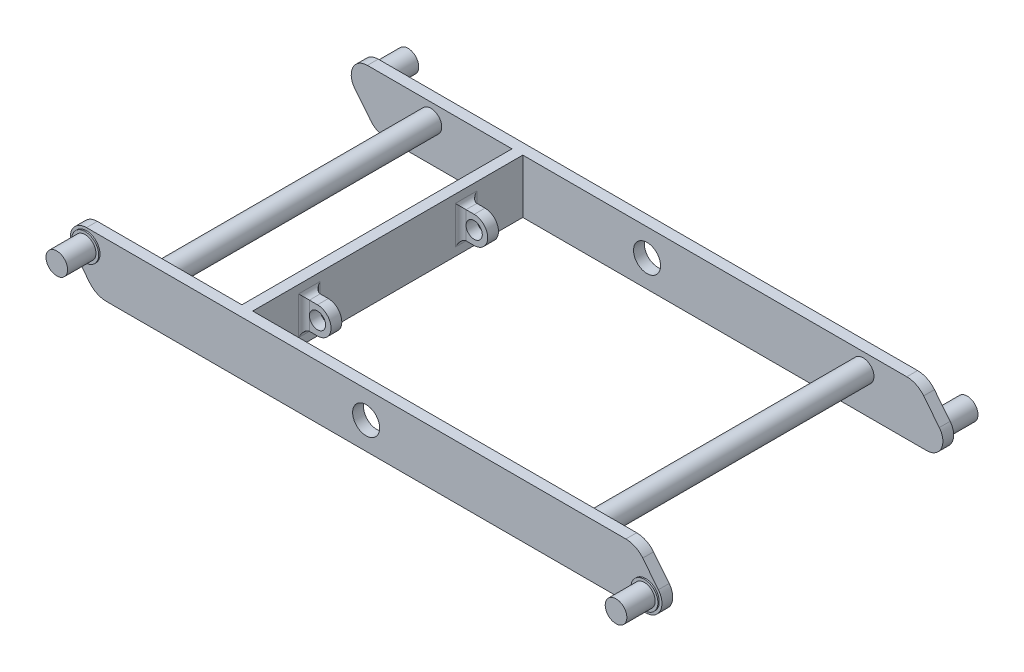
from build123d import *

# Parameters (mm, degrees)
EXTRUDE_1_DEPTH          = 2
SKETCH_3_R               = 2
EXTRUDE_2_DEPTH          = 9
SKETCH_4_R               = 2
EXTRUDE_3_DEPTH          = 25
SKETCH_5_R               = 2.5
CUT_EXTRUDE_2_DEPTH      = 25
SKETCH_7_R               = 2.5
EXTRUDE_4_DEPTH          = 0.25
CUT_EXTRUDE_3_DEPTH      = 61.402419684
CUT_EXTRUDE_3_DEPTH_BACK = 10
SKETCH_8_W               = 14.774450984
SKETCH_8_H               = 5.235041687
SKETCH_8_W_2             = 21.085271114
SKETCH_8_H_2             = 10.942988806
SKETCH_9_W               = 2
SKETCH_9_H               = 10
EXTRUDE_5_DEPTH          = 54
EXTRUDE_START            = 13.5
SKETCH_10_R              = 1.5
EXTRUDE_6_DEPTH          = 2
FILLET_3_R               = 1
FILLET_3_OF_MIRROR_5_R   = 1


with BuildPart() as part:
    # 草圖1 → 填料-伸長1 (new body)
    with BuildSketch(Plane.XY):
        with BuildLine():
            Line((-48.07750061, -5), (51.758125458, -5))
            ThreePointArc((51.758125458, -5), (54.462035166, -3.299566191), (54.100731886, -0.125914857))
            Line((54.100731886, -0.125914857), (51.200975848, 3.49878019))
            ThreePointArc((51.200975848, 3.49878019), (49.810255532, 4.605212945), (48.07750061, 5))
            Line((48.07750061, 5), (-51.758125458, 5))
            ThreePointArc((-51.758125458, 5), (-54.462035166, 3.299566191), (-54.100731886, 0.125914857))
            Line((-54.100731886, 0.125914857), (-51.200975848, -3.49878019))
            ThreePointArc((-51.200975848, -3.49878019), (-49.810255532, -4.605212945), (-48.07750061, -5))
        make_face()
    extrude(amount=EXTRUDE_1_DEPTH)

    # 草圖3 → 填料-伸長2 (add)
    with BuildSketch(Plane.XY.offset(2)):
        with Locations((-51.758125458, 2)):
            Circle(SKETCH_3_R)
        with Locations((51.758125458, -2)):
            Circle(SKETCH_3_R)
    extrude(amount=EXTRUDE_2_DEPTH)

    # 草圖4 → 填料-伸長3 (add)
    with BuildSketch(Plane(origin=(0, 0, 0), x_dir=(-1, 0, 0), z_dir=(0, 0, -1))):
        with Locations(Location((-40, 2, 0), (0, 0, 180))):
            Circle(SKETCH_4_R)
        with Locations(Location((40, 2, 0), (0, 0, 180))):
            Circle(SKETCH_4_R)
    extrude(amount=EXTRUDE_3_DEPTH)

    # 草圖5 → 除料-伸長2 (cut)
    with BuildSketch(Plane(origin=(0, 0, 0), x_dir=(-1, 0, 0), z_dir=(0, 0, -1))):
        Circle(SKETCH_5_R)
    extrude(amount=-CUT_EXTRUDE_2_DEPTH, mode=Mode.SUBTRACT)

    # 草圖7 → 填料-伸長4 (add)
    with BuildSketch(Plane.XY.offset(2)):
        with Locations((51.758125458, -2)):
            Circle(SKETCH_7_R)
        with Locations((-51.758125458, 2)):
            Circle(SKETCH_7_R)
    extrude(amount=EXTRUDE_4_DEPTH)

    # 草圖8 → 除料-伸長3 (cut, two sides: drawn at the far end of the back side and taken through both)
    with BuildSketch(Plane(origin=(0, 0, 0), x_dir=(1, 0, 0), z_dir=(0, 1, 0)).offset(-CUT_EXTRUDE_3_DEPTH_BACK)):
        with Locations((49.50022751, -10.117520844)):
            Rectangle(SKETCH_8_W, SKETCH_8_H)
        with Locations((-50.795099296, -12.971494403)):
            Rectangle(SKETCH_8_W_2, SKETCH_8_H_2)
    extrude(amount=CUT_EXTRUDE_3_DEPTH + CUT_EXTRUDE_3_DEPTH_BACK, mode=Mode.SUBTRACT)

    # 鏡射1: part across plane


with BuildPart() as part_1:
    add(part.part)
    add(part.part.mirror(Plane(origin=(-40, 2, -25), x_dir=(1, 0, 0), z_dir=(0, 0, 1))))

    # 草圖9 → 填料-伸長5 (add)
    with BuildSketch(Plane.XY.offset(2)):
        with Locations((-24, 0)):
            Rectangle(SKETCH_9_W, SKETCH_9_H)
    extrude(amount=-EXTRUDE_5_DEPTH)

    # 草圖10 → 填料-伸長6 (add)
    with BuildSketch(Plane(origin=(0, 0, -25), x_dir=(-1, 0, 0), z_dir=(0, 0, -1)).offset(EXTRUDE_START)):
        with BuildLine():
            Line((23, 2.5), (20.5, 2.5))
            ThreePointArc((20.5, 2.5), (18, 0), (20.5, -2.5))
            Line((20.5, -2.5), (23, -2.5))
            Line((23, -2.5), (23, 2.5))
        make_face()
        with Locations((20.5, 0)):
            Circle(SKETCH_10_R, mode=Mode.SUBTRACT)
    extrude_6 = extrude(amount=EXTRUDE_6_DEPTH)

    # 圓角3
    fillet_3_edges = [part_1.edges().sort_by_distance(p)[0] for p in [
        (-23, 0, -40.5),
        (-23, 0, -38.5),
        (-23, -2.5, -39.5),
        (-23, 2.5, -39.5),
    ]]
    fillet(fillet_3_edges, radius=FILLET_3_R - 0.0001)  # a hair under: the kernel refuses the full size

    # 鏡射5: 填料-伸長6 across plane
    add(extrude_6.mirror(Plane(origin=(0, 0, -25), x_dir=(1, 0, 0), z_dir=(0, 0, -1))))

    # 圓角3 of 鏡射5
    fillet_3_of_mirror_5_edges = [part_1.edges().sort_by_distance(p)[0] for p in [
        (-23, 0, -9.5),
        (-23, 0, -11.5),
        (-23, -2.5, -10.5),
        (-23, 2.5, -10.5),
    ]]
    fillet(fillet_3_of_mirror_5_edges, radius=FILLET_3_OF_MIRROR_5_R - 0.0001)  # a hair under: the kernel refuses the full size


solid = part_1.part
